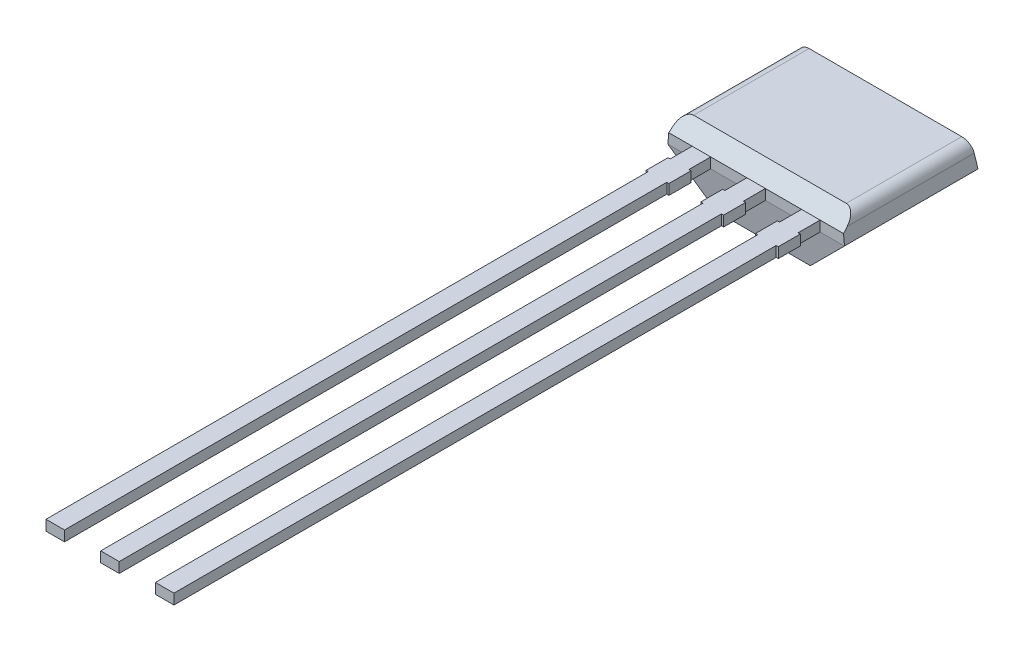
from build123d import *

# Parameters (mm, degrees)
BOSS_EXTRUDE1_DEPTH     = 3.1
BOSS_EXTRUDE2_OUTLINE_W = 0.43
BOSS_EXTRUDE2_OUTLINE_H = 0.24
BOSS_EXTRUDE2_DEPTH     = 15
SKETCH4_W               = 0.53
SKETCH4_H               = 0.51
BOSS_EXTRUDE3_DEPTH     = 0.24


# Read off the part's stored shape, not the designer's step: Boss-Extrude2
with BuildPart() as part:
    # Sketch1 → Boss-Extrude1 (new body)
    with BuildSketch(Plane.XY):
        with BuildLine():
            Line((-1.771923555, 1.52), (1.771923555, 1.52))
            ThreePointArc((1.771923555, 1.52), (1.940821107, 1.454319334), (2.020972229, 1.291788936))
            Line((2.020972229, 1.291788936), (2.05, 0.96))
            Line((2.05, 0.96), (1.09, 0))
            Line((1.09, 0), (-1.09, 0))
            Line((-1.09, 0), (-2.05, 0.96))
            Line((-2.05, 0.96), (-2.020972229, 1.291788936))
            ThreePointArc((-2.020972229, 1.291788936), (-1.940821107, 1.454319334), (-1.771923555, 1.52))
        make_face()
    extrude(amount=BOSS_EXTRUDE1_DEPTH)

    # SurfaceCut1
    split(bisect_by=Plane(origin=(0, 0.028947542, 0.164169669), x_dir=(-1, 0, 0), z_dir=(0, -0.17364817766693072, -0.984807753012208)), keep=Keep.BOTTOM)

    # SurfaceCut2
    split(bisect_by=Plane(origin=(0, -0.50118368, 2.842353893), x_dir=(-1, 0, 0), z_dir=(0, -0.17364817766693072, 0.984807753012208)), keep=Keep.BOTTOM)

    # SurfaceCut3
    split(bisect_by=Plane(origin=(0, 2.15, 2.15), x_dir=(1, 0, 0), z_dir=(0, 0.7071067811865488, 0.7071067811865464)), keep=Keep.BOTTOM)

    # SurfaceCut4
    split(bisect_by=Plane(origin=(0, 0.028947542, -0.164169669), x_dir=(1, 0, 0), z_dir=(0, -0.17364817766693072, 0.984807753012208)), keep=Keep.TOP)


with BuildPart() as body_2:
    # Boss-Extrude2 outline → Boss-Extrude2 (new body)
    with BuildSketch(Plane.XY.offset(3.1)):
        with Locations((1.27, 1.08)):
            Rectangle(BOSS_EXTRUDE2_OUTLINE_W, BOSS_EXTRUDE2_OUTLINE_H)
        with Locations((0, 1.08)):
            Rectangle(BOSS_EXTRUDE2_OUTLINE_W, BOSS_EXTRUDE2_OUTLINE_H)
        with Locations((-1.27, 1.08)):
            Rectangle(BOSS_EXTRUDE2_OUTLINE_W, BOSS_EXTRUDE2_OUTLINE_H)
    extrude(amount=BOSS_EXTRUDE2_DEPTH)

    # Sketch4 → Boss-Extrude3 (add)
    with BuildSketch(Plane(origin=(0, 1.2, 0), x_dir=(1, 0, 0), z_dir=(0, 1, 0))):
        with Locations((-1.27, -3.865)):
            Rectangle(SKETCH4_W, SKETCH4_H)
        with Locations((0, -3.865)):
            Rectangle(SKETCH4_W, SKETCH4_H)
        with Locations((1.27, -3.865)):
            Rectangle(SKETCH4_W, SKETCH4_H)
    extrude(amount=-BOSS_EXTRUDE3_DEPTH)


solid = Compound([part.part, body_2.part])
